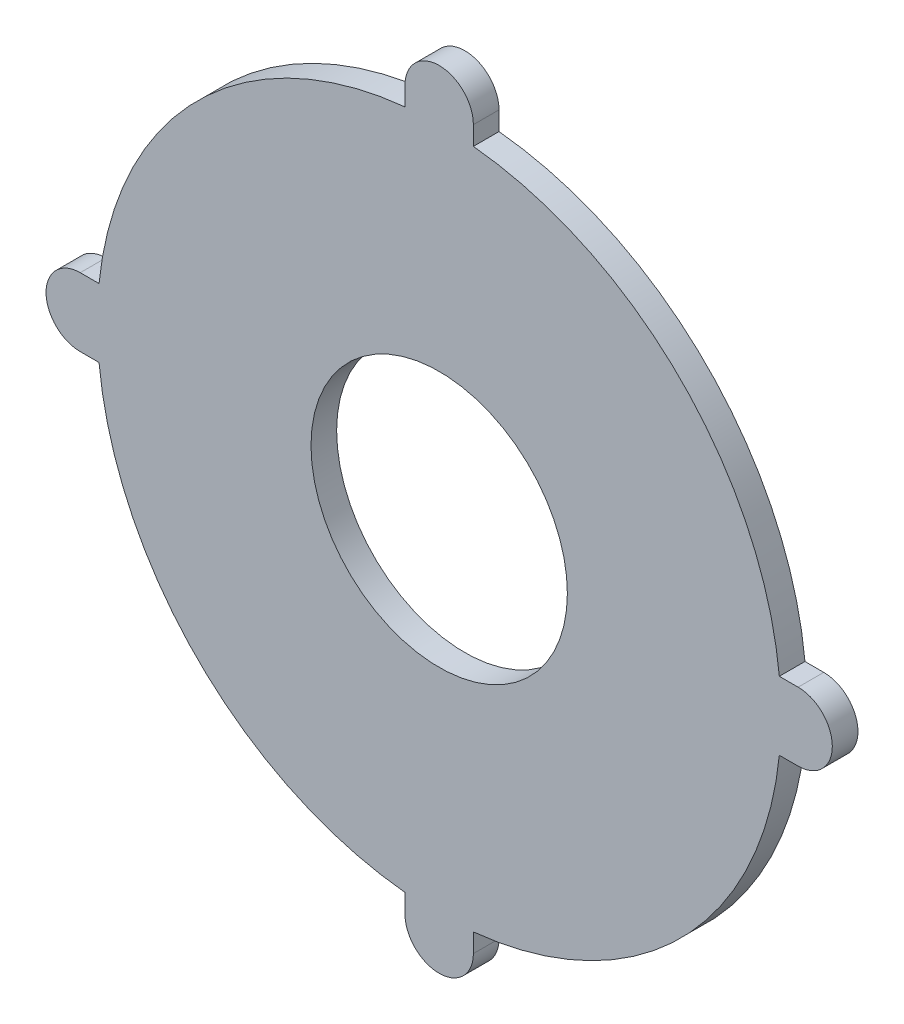
from build123d import *

# Parameters (mm, degrees)
SKETCH_1_R      = 20
SKETCH_1_R_2    = 7.5
EXTRUDE_1_DEPTH = 1.5
EXTRUDE_2_DEPTH = 1.5


with BuildPart() as part:
    # 草图1 → 凸台-拉伸1 (new body)
    with BuildSketch(Plane.XY):
        Circle(SKETCH_1_R)
        Circle(SKETCH_1_R_2, mode=Mode.SUBTRACT)
    extrude(amount=EXTRUDE_1_DEPTH)

    # 草图2 → 凸台-拉伸2 (add)
    with BuildSketch(Plane.XY):
        with BuildLine():
            Line((19, -2), (21, -2))
            ThreePointArc((21, -2), (23, 0), (21, 2))
            Line((21, 2), (19, 2))
            Line((19, 2), (19, -2))
        make_face()
        with BuildLine():
            Line((2, 19), (2, 21))
            ThreePointArc((2, 21), (0, 23), (-2, 21))
            Line((-2, 21), (-2, 19))
            Line((-2, 19), (2, 19))
        make_face()
        with BuildLine():
            Line((-19, 2), (-21, 2))
            ThreePointArc((-21, 2), (-23, 0), (-21, -2))
            Line((-21, -2), (-19, -2))
            Line((-19, -2), (-19, 2))
        make_face()
        with BuildLine():
            Line((-2, -19), (-2, -21))
            ThreePointArc((-2, -21), (0, -23), (2, -21))
            Line((2, -21), (2, -19))
            Line((2, -19), (-2, -19))
        make_face()
    extrude(amount=EXTRUDE_2_DEPTH)


solid = part.part
